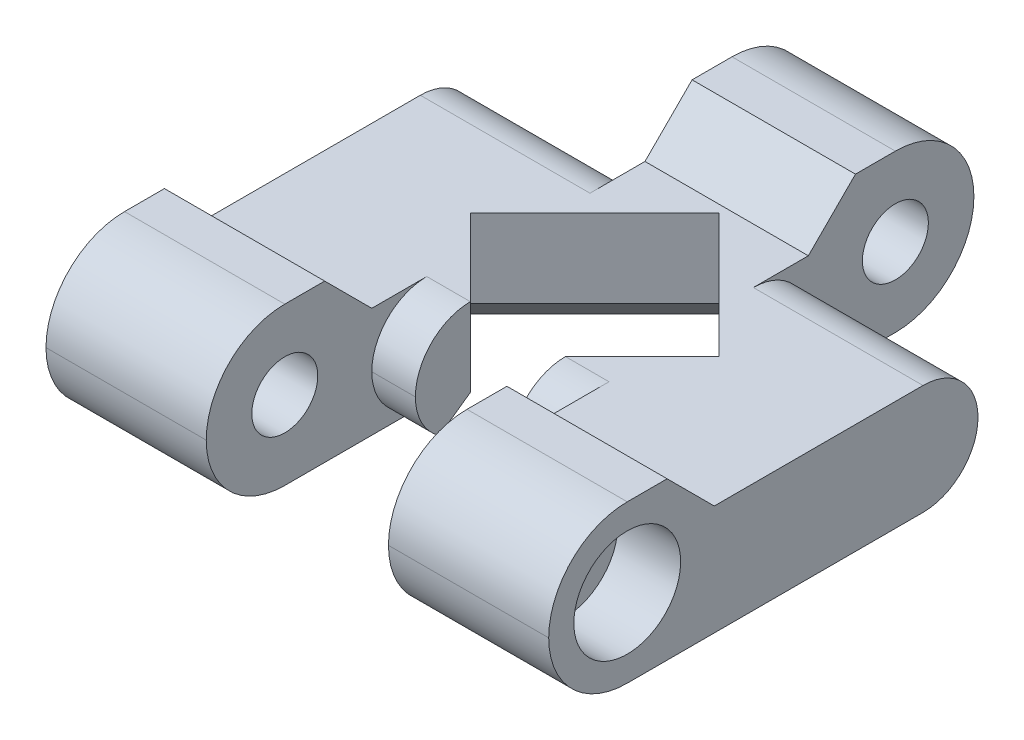
from build123d import *

# Parameters (mm, degrees)
SKETCH3_W           = 18.934254216
SKETCH3_H           = 5
BOSS_EXTRUDE1_DEPTH = 8
CUT_EXTRUDE1_REACH  = 24.954
SKETCH5_R           = 1.05
SKETCH4_W           = 5.27
SKETCH4_H           = 5
CUT_EXTRUDE2_DEPTH  = 2.9
SKETCH6_W           = 5.27
SKETCH6_H           = 5
CUT_EXTRUDE3_DEPTH  = 5.4
CUT_EXTRUDE5_REACH  = 15.365
CUT_EXTRUDE6_REACH  = 24.954
SKETCH10_R          = 1.7
CUT_EXTRUDE9_DEPTH  = 2
FILLET1_R           = 2.5
FILLET2_R           = 1.75
CUT_EXTRUDE7_REACH  = 15.365
SKETCH8_W           = 3.025341734
SKETCH8_H           = 1.75
CHAMFER1_SIZE       = 1


with BuildPart() as part:
    # Sketch3 → Boss-Extrude1 (new body)
    with BuildSketch(Plane.ZY):
        with Locations((0, 16.820132754)):
            Rectangle(SKETCH3_W, SKETCH3_H)
    extrude(amount=-BOSS_EXTRUDE1_DEPTH)

    # Sketch5 → Cut-Extrude1 (cut, up to next)
    with BuildSketch(Plane.ZY, mode=Mode.PRIVATE) as cut_extrude1_sk1:
        with Locations(Location((6.967127108, 16.820132754, 0), (0, 0, 270))):
            Circle(SKETCH5_R)
    cut_extrude1_tool1 = extrude(cut_extrude1_sk1.sketch, amount=-CUT_EXTRUDE1_REACH, mode=Mode.PRIVATE) & part.part
    # Sketch5 → Cut-Extrude1 (cut, up to next)
    with BuildSketch(Plane.ZY, mode=Mode.PRIVATE) as cut_extrude1_sk2:
        with Locations(Location((-6.967127108, 16.820132754, 0), (0, 0, 270))):
            Circle(SKETCH5_R)
    cut_extrude1_tool2 = extrude(cut_extrude1_sk2.sketch, amount=-CUT_EXTRUDE1_REACH, mode=Mode.PRIVATE) & part.part
    add(cut_extrude1_tool1.solids().sort_by_distance((0, 16.820133, 6.967127))[0], mode=Mode.SUBTRACT)
    add(cut_extrude1_tool2.solids().sort_by_distance((0, 16.820133, -6.967127))[0], mode=Mode.SUBTRACT)

    # Sketch4 → Cut-Extrude2 (cut)
    with BuildSketch(Plane.ZY):
        with Locations((6.832127108, 16.820132754)):
            Rectangle(SKETCH4_W, SKETCH4_H)
    extrude(amount=-CUT_EXTRUDE2_DEPTH, mode=Mode.SUBTRACT)

    # Sketch6 → Cut-Extrude3 (cut)
    with BuildSketch(Plane(origin=(8, 0, 0), x_dir=(0, 0, -1), z_dir=(1, 0, 0))):
        with Locations((6.832127108, 16.820132754)):
            Rectangle(SKETCH6_W, SKETCH6_H)
    extrude(amount=-CUT_EXTRUDE3_DEPTH, mode=Mode.SUBTRACT)

    # Sketch1 → Cut-Extrude5 (cut, up to next)
    with BuildSketch(Plane(origin=(0, 14.320132754, 0), x_dir=(-1, 0, 0), z_dir=(0, -1, 0)), mode=Mode.PRIVATE) as cut_extrude5_sk1:
        Polygon((3.959797975, 0), (0, -3.959797975), (-3.959797975, 0), (0, 3.959797975), align=None)
    cut_extrude5_tool1 = extrude(cut_extrude5_sk1.sketch, amount=-CUT_EXTRUDE5_REACH, mode=Mode.PRIVATE) & part.part
    add(cut_extrude5_tool1.solids().sort_by_distance((0, 14.320133, 0))[0], mode=Mode.SUBTRACT)

    # Sketch7 → Cut-Extrude6 (cut, up to next)
    with BuildSketch(Plane.ZY, mode=Mode.PRIVATE) as cut_extrude6_sk1:
        Polygon((-4.197127108, 17.820132754), (4.197127108, 17.820132754), (5.697127108, 19.320132754), (-5.697127108, 19.320132754), align=None)
    cut_extrude6_tool1 = extrude(cut_extrude6_sk1.sketch, amount=-CUT_EXTRUDE6_REACH, mode=Mode.PRIVATE) & part.part
    add(cut_extrude6_tool1.solids().sort_by_distance((0, 18.608034, 0))[0], mode=Mode.SUBTRACT)

    # Sketch10 → Cut-Extrude9 (cut)
    with BuildSketch(Plane(origin=(8, 0, 0), x_dir=(0, 0, -1), z_dir=(1, 0, 0))):
        with Locations(Location((-6.967127108, 16.820132754, 0), (0, 0, 90))):
            Circle(SKETCH10_R)
    extrude(amount=-CUT_EXTRUDE9_DEPTH, mode=Mode.SUBTRACT)

    # Mirror2: part across plane


with BuildPart() as part_1:
    add(part.part)
    add(part.part.mirror(Plane(origin=(0, 0, 0), x_dir=(0, 0, 1), z_dir=(1, 0, 0))))

    # Fillet1
    # the kernel refuses this fillet: 2.5 mm, written as the material it takes off along each edge
    with BuildSketch(Plane(origin=(3.35, 14.320132754, 9.467127108), x_dir=(0, 0, -1), z_dir=(-1, 0, 0)), Plane(origin=(-3.35, 19.320132754, 9.467127108), x_dir=(0, 0, -1), z_dir=(1, 0, 0))) as fillet1_piece_1:
        with BuildLine():
            CenterArc((FILLET1_R, -FILLET1_R), FILLET1_R, 90, 90)
            Line((0, -FILLET1_R), (0, 0))
            Line((0, 0), (FILLET1_R, 0))
        make_face()
    extrude(amount=17.6, mode=Mode.SUBTRACT)
    with BuildSketch(Plane(origin=(3.35, 19.320132754, 9.467127108), x_dir=(0, 0, -1), z_dir=(-1, 0, 0)), Plane(origin=(-3.35, 14.320132754, 9.467127108), x_dir=(0, 0, -1), z_dir=(1, 0, 0))) as fillet1_piece_2:
        with BuildLine():
            CenterArc((FILLET1_R, FILLET1_R), FILLET1_R, 180, 90)
            Line((0, FILLET1_R), (0, 0))
            Line((0, 0), (FILLET1_R, 0))
        make_face()
    extrude(amount=17.6, mode=Mode.SUBTRACT)
    with BuildSketch(Plane(origin=(-8.85, 14.320132754, -9.467127108), x_dir=(0, 0, 1), z_dir=(1, 0, 0))) as fillet1_piece_3:
        with BuildLine():
            CenterArc((FILLET1_R, -FILLET1_R), FILLET1_R, 90, 90)
            Line((0, -FILLET1_R), (0, 0))
            Line((0, 0), (FILLET1_R, 0))
        make_face()
    extrude(amount=17.7, mode=Mode.SUBTRACT)
    with BuildSketch(Plane(origin=(-8.85, 19.320132754, -9.467127108), x_dir=(0, 0, 1), z_dir=(1, 0, 0))) as fillet1_piece_4:
        with BuildLine():
            CenterArc((FILLET1_R, FILLET1_R), FILLET1_R, 180, 90)
            Line((0, FILLET1_R), (0, 0))
            Line((0, 0), (FILLET1_R, 0))
        make_face()
    extrude(amount=17.7, mode=Mode.SUBTRACT)

    # Fillet2
    # the kernel refuses this fillet: 1.75 mm, written as the material it takes off along each edge
    with BuildSketch(Plane(origin=(2.9, 14.320132754, 4.197127108), x_dir=(0, 0, -1), z_dir=(-1, 0, 0))) as fillet2_piece_1:
        with BuildLine():
            CenterArc((FILLET2_R, -FILLET2_R), FILLET2_R, 90, 90)
            Line((0, -FILLET2_R), (0, 0))
            Line((0, 0), (FILLET2_R, 0))
        make_face()
    extrude(amount=5.8, mode=Mode.SUBTRACT)
    with BuildSketch(Plane(origin=(2.9, 17.820132754, 4.197127108), x_dir=(0, 0, -1), z_dir=(-1, 0, 0))) as fillet2_piece_2:
        with BuildLine():
            CenterArc((FILLET2_R, FILLET2_R), FILLET2_R, 180, 90)
            Line((0, FILLET2_R), (0, 0))
            Line((0, 0), (FILLET2_R, 0))
        make_face()
    extrude(amount=5.8, mode=Mode.SUBTRACT)
    with BuildSketch(Plane(origin=(12.375, 14.320132754, -4.197127108), x_dir=(0, 0, 1), z_dir=(-1, 0, 0)), Plane(origin=(2.6, 17.820132754, -4.197127108), x_dir=(0, 0, 1), z_dir=(1, 0, 0))) as fillet2_piece_3:
        with BuildLine():
            CenterArc((FILLET2_R, FILLET2_R), FILLET2_R, 180, 90)
            Line((0, FILLET2_R), (0, 0))
            Line((0, 0), (FILLET2_R, 0))
        make_face()
    extrude(amount=9.775, mode=Mode.SUBTRACT)
    with BuildSketch(Plane(origin=(-12.375, 14.320132754, -4.197127108), x_dir=(0, 0, 1), z_dir=(1, 0, 0)), Plane(origin=(-2.6, 17.820132754, -4.197127108), x_dir=(0, 0, 1), z_dir=(-1, 0, 0))) as fillet2_piece_4:
        with BuildLine():
            CenterArc((FILLET2_R, -FILLET2_R), FILLET2_R, 90, 90)
            Line((0, -FILLET2_R), (0, 0))
            Line((0, 0), (FILLET2_R, 0))
        make_face()
    extrude(amount=9.775, mode=Mode.SUBTRACT)

    # Sketch8 → Cut-Extrude7 (cut, up to next)
    with BuildSketch(Plane(origin=(0, 14.320132754, 0), x_dir=(1, 0, 0), z_dir=(0, 1, 0)), mode=Mode.PRIVATE) as cut_extrude7_sk1:
        with Locations((0, -3.322127108)):
            Rectangle(SKETCH8_W, SKETCH8_H)
    cut_extrude7_tool1 = extrude(cut_extrude7_sk1.sketch, amount=CUT_EXTRUDE7_REACH, mode=Mode.PRIVATE) & part_1.part
    add(cut_extrude7_tool1.solids().sort_by_distance((0, 14.320133, 3.322127))[0], mode=Mode.SUBTRACT)

    # Chamfer1
    # the kernel refuses this chamfer: 1 mm, written as the material it takes off along each edge
    with BuildSketch(Plane(origin=(0.305783613, 14.320132754, 4.265581587), x_dir=(-0.7068394360706736, -0.027495876610585612, 0.7068394360706735), z_dir=(-0.7071067811865476, 0, -0.7071067811865476))) as chamfer1_piece_1:
        Polygon((CHAMFER1_SIZE * 0.999621916911, CHAMFER1_SIZE * 0.0274958766106), (-CHAMFER1_SIZE * 0.0274958766106, CHAMFER1_SIZE * 0.999621916911), (0, 0), align=None)
    extrude(amount=6.032443332, mode=Mode.SUBTRACT)
    with BuildSketch(Plane(origin=(-0.305783613, 14.320132754, 4.265581587), x_dir=(0.7068394360706735, -0.027495876610585612, 0.7068394360706735), z_dir=(0.7071067811865476, 0, -0.7071067811865476))) as chamfer1_piece_2:
        Polygon((CHAMFER1_SIZE * 0.999621916911, -CHAMFER1_SIZE * 0.0274958766106), (-CHAMFER1_SIZE * 0.0274958766106, -CHAMFER1_SIZE * 0.999621916911), (0, 0), align=None)
    extrude(amount=6.032443332, mode=Mode.SUBTRACT)
    with BuildSketch(Plane(origin=(3.959797975, 14.320132754, 0), x_dir=(0.7068394360706735, -0.027495876610590834, -0.7068394360706735), z_dir=(-0.7071067811865476, 0, -0.7071067811865476))) as chamfer1_piece_3:
        Polygon((CHAMFER1_SIZE * 0.999621916911, -CHAMFER1_SIZE * 0.0274958766106), (-CHAMFER1_SIZE * 0.0274958766106, -CHAMFER1_SIZE * 0.999621916911), (0, 0), align=None)
    extrude(amount=5.6, mode=Mode.SUBTRACT)
    with BuildSketch(Plane(origin=(-3.959797975, 14.320132754, 0), x_dir=(-0.7068394360706735, -0.027495876610590834, -0.7068394360706735), z_dir=(0.7071067811865476, 0, -0.7071067811865476))) as chamfer1_piece_4:
        Polygon((CHAMFER1_SIZE * 0.999621916911, CHAMFER1_SIZE * 0.0274958766106), (-CHAMFER1_SIZE * 0.0274958766106, CHAMFER1_SIZE * 0.999621916911), (0, 0), align=None)
    extrude(amount=5.6, mode=Mode.SUBTRACT)
    with BuildSketch(Plane(origin=(-5.778252454, 14.320132754, 1.81845448), x_dir=(-0.7068394360706735, -0.027495876610585616, -0.7068394360706735), z_dir=(0.7071067811865476, 0, -0.7071067811865476))) as chamfer1_piece_5a_section:
        Polygon((CHAMFER1_SIZE * 0.999621916911, CHAMFER1_SIZE * 0.0274958766106), (-CHAMFER1_SIZE * 0.0274958766106, CHAMFER1_SIZE * 0.999621916911), (0, 0), align=None)
    chamfer1_piece_5a = extrude(amount=8.171682988, mode=Mode.PRIVATE)
    chamfer1_piece_5a = split(chamfer1_piece_5a, bisect_by=Plane(origin=(-4.192997285, 14.649926381, -0.23319931), z_dir=(-0.7071067811865476, 0, 0.7071067811865476)), keep=Keep.TOP, mode=Mode.PRIVATE)
    with BuildSketch(Plane(origin=(0.305783613, 14.320132754, 4.265581587), x_dir=(-0.7068394360706736, -0.027495876610585612, 0.7068394360706735), z_dir=(-0.7071067811865476, 0, -0.7071067811865476))) as chamfer1_piece_5b_section:
        Polygon((CHAMFER1_SIZE * 0.999621916911, CHAMFER1_SIZE * 0.0274958766106), (-CHAMFER1_SIZE * 0.0274958766106, CHAMFER1_SIZE * 0.999621916911), (0, 0), align=None)
    chamfer1_piece_5b = extrude(amount=8.60412632, mode=Mode.PRIVATE)
    chamfer1_piece_5b = split(chamfer1_piece_5b, bisect_by=Plane(origin=(-4.192997285, 14.649926381, 0.23319931), z_dir=(-0.7071067811865476, 0, -0.7071067811865476)), keep=Keep.TOP, mode=Mode.PRIVATE)
    chamfer1_piece_5 = chamfer1_piece_5a & chamfer1_piece_5b
    add(chamfer1_piece_5, mode=Mode.SUBTRACT)
    with BuildSketch(Plane(origin=(-0.305783613, 14.320132754, 4.265581587), x_dir=(0.7068394360706735, -0.027495876610585612, 0.7068394360706735), z_dir=(0.7071067811865476, 0, -0.7071067811865476))) as chamfer1_piece_6a_section:
        Polygon((CHAMFER1_SIZE * 0.999621916911, -CHAMFER1_SIZE * 0.0274958766106), (-CHAMFER1_SIZE * 0.0274958766106, -CHAMFER1_SIZE * 0.999621916911), (0, 0), align=None)
    chamfer1_piece_6a = extrude(amount=8.60412632, mode=Mode.PRIVATE)
    chamfer1_piece_6a = split(chamfer1_piece_6a, bisect_by=Plane(origin=(4.192997285, 14.649926381, 0.23319931), z_dir=(0.7071067811865476, 0, -0.7071067811865476)), keep=Keep.TOP, mode=Mode.PRIVATE)
    with BuildSketch(Plane(origin=(5.778252454, 14.320132754, 1.81845448), x_dir=(0.7068394360706736, -0.027495876610585605, -0.7068394360706736), z_dir=(-0.7071067811865476, 0, -0.7071067811865476))) as chamfer1_piece_6b_section:
        Polygon((CHAMFER1_SIZE * 0.999621916911, -CHAMFER1_SIZE * 0.0274958766106), (-CHAMFER1_SIZE * 0.0274958766106, -CHAMFER1_SIZE * 0.999621916911), (0, 0), align=None)
    chamfer1_piece_6b = extrude(amount=8.171682988, mode=Mode.PRIVATE)
    chamfer1_piece_6b = split(chamfer1_piece_6b, bisect_by=Plane(origin=(4.192997285, 14.649926381, -0.23319931), z_dir=(0.7071067811865476, 0, 0.7071067811865476)), keep=Keep.TOP, mode=Mode.PRIVATE)
    chamfer1_piece_6 = chamfer1_piece_6a & chamfer1_piece_6b
    add(chamfer1_piece_6, mode=Mode.SUBTRACT)
    with BuildSketch(Plane(origin=(3.959797975, 14.320132754, 0), x_dir=(0.7068394360706735, -0.027495876610590834, -0.7068394360706735), z_dir=(-0.7071067811865476, 0, -0.7071067811865476))) as chamfer1_piece_7a_section:
        Polygon((CHAMFER1_SIZE * 0.999621916911, -CHAMFER1_SIZE * 0.0274958766106), (-CHAMFER1_SIZE * 0.0274958766106, -CHAMFER1_SIZE * 0.999621916911), (0, 0), align=None)
    chamfer1_piece_7a = extrude(amount=8.171682988, mode=Mode.PRIVATE)
    chamfer1_piece_7a = split(chamfer1_piece_7a, bisect_by=Plane(origin=(0.23319931, 14.649926381, -4.192997285), z_dir=(-0.7071067811865476, 0, -0.7071067811865476)), keep=Keep.TOP, mode=Mode.PRIVATE)
    with BuildSketch(Plane(origin=(-3.959797975, 14.320132754, 0), x_dir=(-0.7068394360706735, -0.027495876610590834, -0.7068394360706735), z_dir=(0.7071067811865476, 0, -0.7071067811865476))) as chamfer1_piece_7b_section:
        Polygon((CHAMFER1_SIZE * 0.999621916911, CHAMFER1_SIZE * 0.0274958766106), (-CHAMFER1_SIZE * 0.0274958766106, CHAMFER1_SIZE * 0.999621916911), (0, 0), align=None)
    chamfer1_piece_7b = extrude(amount=8.171682988, mode=Mode.PRIVATE)
    chamfer1_piece_7b = split(chamfer1_piece_7b, bisect_by=Plane(origin=(-0.23319931, 14.649926381, -4.192997285), z_dir=(0.7071067811865476, 0, -0.7071067811865476)), keep=Keep.TOP, mode=Mode.PRIVATE)
    chamfer1_piece_7 = chamfer1_piece_7a & chamfer1_piece_7b
    add(chamfer1_piece_7, mode=Mode.SUBTRACT)


solid = part_1.part
